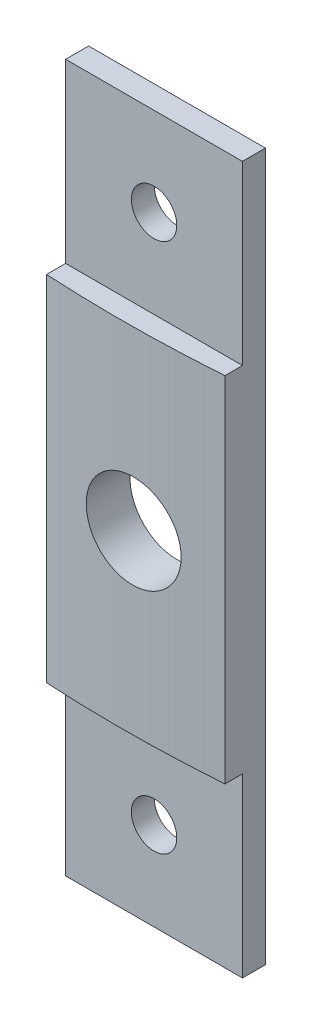
from build123d import *

# Parameters (mm, degrees)
SKETCH1_W                = 12.7
SKETCH1_H                = 50.8
BOSS_EXTRUDE1_DEPTH      = 3.175
CUT_EXTRUDE1_DEPTH       = 42.237466092
CUT_EXTRUDE1_DEPTH_BACK  = 42.237466092
SKETCH4_W                = 1.524
SKETCH4_H                = 12.7
CUT_EXTRUDE9_START       = 2.374796748
CUT_EXTRUDE9_DEPTH       = 25.4
CUT_EXTRUDE15_DEPTH      = 42.237466092
CUT_EXTRUDE15_DEPTH_BACK = 2.54
SKETCH7_R                = 1.63195
SKETCH7_R_2              = 3.3782


# Read off the part's stored shape, not the designer's step: Cut-Extrude9
with BuildPart() as part:
    # Sketch1 → Boss-Extrude1 (new body)
    with BuildSketch(Plane.XY):
        with Locations((0.877642276, 15.074796748)):
            Rectangle(SKETCH1_W, SKETCH1_H)
    extrude(amount=BOSS_EXTRUDE1_DEPTH)

    # Sketch4 → Cut-Extrude1 (cut, two sides: drawn at the far end of the back side and taken through both)
    with BuildSketch(Plane(origin=(0, 0, 0), x_dir=(0, 0, -1), z_dir=(1, 0, 0)).offset(-CUT_EXTRUDE1_DEPTH_BACK)):
        with Locations((-2.413, 34.124796748)):
            Rectangle(SKETCH4_W, SKETCH4_H)
        with Locations((-2.413, -3.975203252)):
            Rectangle(SKETCH4_W, SKETCH4_H)
    extrude(amount=CUT_EXTRUDE1_DEPTH + CUT_EXTRUDE1_DEPTH_BACK, mode=Mode.SUBTRACT)

    # Cut-Extrude9 outline → Cut-Extrude9 (cut)
    with BuildSketch(Plane(origin=(0, 0, 0), x_dir=(1, 0, 0), z_dir=(0, 1, 0)).offset(CUT_EXTRUDE9_START)):
        with BuildLine():
            ThreePointArc((7.227642276, -2.909267581), (3.616263069, -3.10854445), (5.36e-07, -3.175))
            Line((5.36e-07, -3.175), (7.227642276, -3.175))
            Line((7.227642276, -3.175), (7.227642276, -2.909267581))
        make_face()
        with BuildLine():
            ThreePointArc((5.36e-07, -3.175), (-2.737237313, -3.136930824), (-5.472357724, -3.022752714))
            Line((-5.472357724, -3.022752714), (-5.472357724, -3.175))
            Line((-5.472357724, -3.175), (5.36e-07, -3.175))
        make_face()
    extrude(amount=CUT_EXTRUDE9_DEPTH, mode=Mode.SUBTRACT)

    # Sketch7 → Cut-Extrude15 (cut, two sides: drawn at the far end of the back side and taken through both)
    with BuildSketch(Plane.XY.offset(-CUT_EXTRUDE15_DEPTH_BACK)):
        with Locations(Location((0.877642276, -3.975203252, 0), (0, 0, 180))):
            Circle(SKETCH7_R)
        with Locations(Location((0.877642276, 34.124796748, 0), (0, 0, 180))):
            Circle(SKETCH7_R)
        with Locations(Location((0.877642276, 15.074796748, 0), (0, 0, 105.05794783))):
            Circle(SKETCH7_R_2)
    extrude(amount=CUT_EXTRUDE15_DEPTH + CUT_EXTRUDE15_DEPTH_BACK, mode=Mode.SUBTRACT)


solid = part.part
